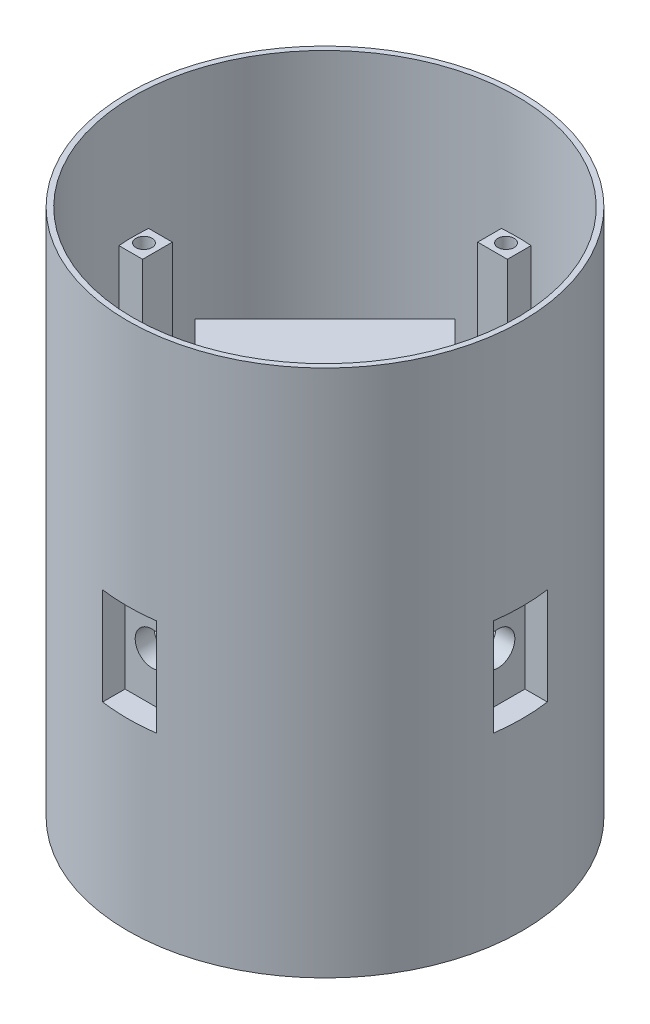
from build123d import *
from build123d.topology import SkipClean

# Parameters (mm, degrees)
SKETCH_4_W                = 68
SKETCH_4_H                = 1.5
EXTRUDE_1_DEPTH           = 34
EXTRUDE_1_2_DEPTH         = 34
EXTRUDE_1_3_DEPTH         = 34
EXTRUDE_1_4_DEPTH         = 34
EXTRUDE_1_5_DEPTH         = 34
SKETCH_1_R                = 73
SKETCH_1_R_2              = 71
EXTRUDE_2_DEPTH           = 97.5
EXTRUDE_START             = 33
SKETCH_6_W                = 24
SKETCH_6_H                = 10
EXTRUDE_4_DEPTH           = 20
EXTRUDE_START_2           = 62.006944
SKETCH_5_R                = 8.25
EXTRUDE_5_DEPTH           = 5
PATTERN_CIRCULAR_1_COUNT  = 4
SHELL_START               = -73.0000001
SHELL_4_OUTLINE_W         = 20
SHELL_4_OUTLINE_H         = 36
SHELL_4_DEPTH             = 8.99305599
SHELL_START_2             = 64.00694411
SHELL_4_2_OUTLINE_W       = 20
SHELL_4_2_OUTLINE_H       = 36
SHELL_4_2_DEPTH           = 8.99305589
SHELL_START_3             = -64.00694411
SHELL_4_3_OUTLINE_R       = 6.25
SHELL_4_3_DEPTH           = 5
SHELL_START_4             = 59.00694411
SHELL_4_4_OUTLINE_R       = 6.25
SHELL_4_4_DEPTH           = 5
SHELL_4_5_OUTLINE_W       = 36
SHELL_4_5_OUTLINE_H       = 20
SHELL_4_5_DEPTH           = 8.99305599
SHELL_4_6_OUTLINE_W       = 36
SHELL_4_6_OUTLINE_H       = 20
SHELL_4_6_DEPTH           = 8.99305589
SHELL_4_7_OUTLINE_R       = 6.25
SHELL_4_7_DEPTH           = 5
SHELL_4_8_OUTLINE_R       = 6.25
SHELL_4_8_DEPTH           = 5
SKETCH_8_R                = 6.25
CUT_EXTRUDE_7_DEPTH       = 2
PATTERN_CIRCULAR_17_COUNT = 4
SKETCH_1_43_R             = 73
EXTRUDE_6_DEPTH           = 8
EXTRUDE_START_3           = 53
SKETCH_6_4_W              = 11
SKETCH_6_4_H              = 10
EXTRUDE_7_DEPTH           = 44.5
PATTERN_CIRCULAR_18_COUNT = 4
SKETCH_10_R               = 6.65
CUT_EXTRUDE_8_DEPTH       = 8
EXTRUDE_4_2_DEPTH         = 8
SKETCH_9_3_R              = 1.5
CUT_EXTRUDE_9_DEPTH       = 6
SKETCH_11_R               = 1.5
CUT_EXTRUDE_10_DEPTH      = 6
CUT_EXTRUDE_START         = 97.5
SKETCH_6_7_R              = 3
CUT_EXTRUDE_11_DEPTH      = 6
PATTERN_CIRCULAR_19_COUNT = 4
EXTRUDE_START_4           = 97.5
SKETCH_1_44_R             = 73
SKETCH_1_44_R_2           = 71
EXTRUDE_9_DEPTH           = 45
EXTRUDE_START_5           = -8
SKETCH_1_45_R             = 73
SKETCH_1_45_R_2           = 71
EXTRUDE_10_DEPTH          = 45
SKETCH_1_46_R             = 1.5
CUT_EXTRUDE_12_DEPTH      = 6


# Read off the part's stored shape, not the designer's step: 薄殼4
with BuildPart() as part:
    # 草圖4 → 填料-伸長1 (new, symmetric)
    with BuildSketch(Plane(origin=(0, 0, 0), x_dir=(-0.7071067811865477, 0, 0.7071067811865475), z_dir=(-0.7071067811865475, 0, -0.7071067811865477))):
        with Locations((0, 15.75)):
            Rectangle(SKETCH_4_W, SKETCH_4_H)
    extrude(amount=EXTRUDE_1_DEPTH, both=True)


with BuildPart() as body_2:
    # 草圖4 → Extrude 1 2 (new, symmetric)
    with BuildSketch(Plane(origin=(0, 0, 0), x_dir=(-0.7071067811865477, 0, 0.7071067811865475), z_dir=(-0.7071067811865475, 0, -0.7071067811865477))):
        with Locations((0, 32.25)):
            Rectangle(SKETCH_4_W, SKETCH_4_H)
    extrude(amount=EXTRUDE_1_2_DEPTH, both=True)


with BuildPart() as body_3:
    # 草圖4 → Extrude 1 3 (new, symmetric)
    with BuildSketch(Plane(origin=(0, 0, 0), x_dir=(-0.7071067811865477, 0, 0.7071067811865475), z_dir=(-0.7071067811865475, 0, -0.7071067811865477))):
        with Locations((0, 48.75)):
            Rectangle(SKETCH_4_W, SKETCH_4_H)
    extrude(amount=EXTRUDE_1_3_DEPTH, both=True)


with BuildPart() as body_4:
    # 草圖4 → Extrude 1 4 (new, symmetric)
    with BuildSketch(Plane(origin=(0, 0, 0), x_dir=(-0.7071067811865477, 0, 0.7071067811865475), z_dir=(-0.7071067811865475, 0, -0.7071067811865477))):
        with Locations((0, 65.25)):
            Rectangle(SKETCH_4_W, SKETCH_4_H)
    extrude(amount=EXTRUDE_1_4_DEPTH, both=True)


with BuildPart() as body_5:
    # 草圖4 → Extrude 1 5 (new, symmetric)
    with BuildSketch(Plane(origin=(0, 0, 0), x_dir=(-0.7071067811865477, 0, 0.7071067811865475), z_dir=(-0.7071067811865475, 0, -0.7071067811865477))):
        with Locations((0, 81.75)):
            Rectangle(SKETCH_4_W, SKETCH_4_H)
    extrude(amount=EXTRUDE_1_5_DEPTH, both=True)


with BuildPart() as body_6:
    # 草圖1 → 填料-伸長2 (new body)
    with BuildSketch(Plane(origin=(0, 0, 0), x_dir=(1, 0, 0), z_dir=(0, 1, 0))):
        with Locations(Location((0, 0, 0), (0, 0, 270))):
            Circle(SKETCH_1_R)
        with Locations(Location((0, 0, 0), (0, 0, 270))):
            Circle(SKETCH_1_R_2, mode=Mode.SUBTRACT)
    extrude(amount=EXTRUDE_2_DEPTH)

    # 草圖6 → Extrude 4 (add, symmetric)
    with BuildSketch(Plane(origin=(0, 0, 0), x_dir=(1, 0, 0), z_dir=(0, 1, 0)).offset(EXTRUDE_START)):
        with Locations((0, -67.00694411)):
            Rectangle(SKETCH_6_W, SKETCH_6_H)
    extrude_4 = extrude(amount=EXTRUDE_4_DEPTH, both=True)

    # 草圖5 → 填料-伸長5 (add)
    with BuildSketch(Plane.XY.offset(EXTRUDE_START_2)):
        with Locations(Location((0, 33, 0), (0, 0, 180))):
            Circle(SKETCH_5_R)
    extrude_5 = extrude(amount=-EXTRUDE_5_DEPTH)

    # 環狀複製排列1: Extrude 4, 填料-伸長5 ×4 about axis
    pattern_circular_1_axis = Axis((0, 0, 0), (0, 1, 0))
    add([extrude_4.rotate(pattern_circular_1_axis, i * 360 / PATTERN_CIRCULAR_1_COUNT) for i in range(1, PATTERN_CIRCULAR_1_COUNT)])
    add([extrude_5.rotate(pattern_circular_1_axis, i * 360 / PATTERN_CIRCULAR_1_COUNT) for i in range(1, PATTERN_CIRCULAR_1_COUNT)])

    # 薄殼4 outline → 薄殼4 (cut)
    with BuildSketch(Plane.XY.offset(SHELL_START)):
        with Locations((0, 33)):
            Rectangle(SHELL_4_OUTLINE_W, SHELL_4_OUTLINE_H)
    extrude(amount=SHELL_4_DEPTH, mode=Mode.SUBTRACT)

    # Shell 4 2 outline → Shell 4 2 (cut)
    with BuildSketch(Plane.XY.offset(SHELL_START_2)):
        with Locations((0, 33)):
            Rectangle(SHELL_4_2_OUTLINE_W, SHELL_4_2_OUTLINE_H)
    extrude(amount=SHELL_4_2_DEPTH, mode=Mode.SUBTRACT)

    # Shell 4 3 outline → Shell 4 3 (cut)
    with BuildSketch(Plane.XY.offset(SHELL_START_3)):
        with Locations((0, 33)):
            Circle(SHELL_4_3_OUTLINE_R)
    extrude(amount=SHELL_4_3_DEPTH, mode=Mode.SUBTRACT)

    # Shell 4 4 outline → Shell 4 4 (cut)
    with BuildSketch(Plane.XY.offset(SHELL_START_4)):
        with Locations((0, 33)):
            Circle(SHELL_4_4_OUTLINE_R)
    extrude(amount=SHELL_4_4_DEPTH, mode=Mode.SUBTRACT)

    # Shell 4 5 outline → Shell 4 5 (cut)
    with BuildSketch(Plane.YZ.offset(SHELL_START)):
        with Locations((33, 0)):
            Rectangle(SHELL_4_5_OUTLINE_W, SHELL_4_5_OUTLINE_H)
    extrude(amount=SHELL_4_5_DEPTH, mode=Mode.SUBTRACT)

    # Shell 4 6 outline → Shell 4 6 (cut)
    with BuildSketch(Plane.YZ.offset(SHELL_START_2)):
        with Locations((33, 0)):
            Rectangle(SHELL_4_6_OUTLINE_W, SHELL_4_6_OUTLINE_H)
    extrude(amount=SHELL_4_6_DEPTH, mode=Mode.SUBTRACT)

    # Shell 4 7 outline → Shell 4 7 (cut)
    with BuildSketch(Plane.YZ.offset(SHELL_START_3)):
        with Locations((33, 0)):
            Circle(SHELL_4_7_OUTLINE_R)
    extrude(amount=SHELL_4_7_DEPTH, mode=Mode.SUBTRACT)

    # Shell 4 8 outline → Shell 4 8 (cut)
    with BuildSketch(Plane.YZ.offset(SHELL_START_4)):
        with Locations((33, 0)):
            Circle(SHELL_4_8_OUTLINE_R)
    extrude(amount=SHELL_4_8_DEPTH, mode=Mode.SUBTRACT)

    # 草圖8 → 除料-伸長7 (cut)
    with BuildSketch(Plane.ZY.offset(59.00694411)):
        with Locations((0, 33)):
            Circle(SKETCH_8_R)
    cut_extrude_7 = extrude(amount=-CUT_EXTRUDE_7_DEPTH, mode=Mode.SUBTRACT)

    # 環狀複製排列17: 除料-伸長7 ×4 about axis
    with SkipClean():  # the faces are left unmerged after this step: merging them gives an invalid solid
        pattern_circular_17_axis = Axis((0, 97.5, 0), (0, -1, 0))
        for i in range(1, PATTERN_CIRCULAR_17_COUNT):
            add(cut_extrude_7.rotate(pattern_circular_17_axis, i * 360 / PATTERN_CIRCULAR_17_COUNT), mode=Mode.SUBTRACT)

    # 草圖1<43> → 填料-伸長6 (add)
    with BuildSketch(Plane(origin=(0, 0, 0), x_dir=(1, 0, 0), z_dir=(0, 1, 0))):
        with Locations(Location((0, 0, 0), (0, 0, 270))):
            Circle(SKETCH_1_43_R)
    extrude(amount=-EXTRUDE_6_DEPTH)

    # 草圖6<4> → 填料-伸長7 (add)
    with BuildSketch(Plane(origin=(0, 0, 0), x_dir=(1, 0, 0), z_dir=(0, 1, 0)).offset(EXTRUDE_START_3)):
        with Locations((0, -67.00694411)):
            Rectangle(SKETCH_6_4_W, SKETCH_6_4_H)
    extrude_7 = extrude(amount=EXTRUDE_7_DEPTH)

    # 環狀複製排列18: 填料-伸長7 ×4 about axis
    pattern_circular_18_axis = Axis((0, 0, 0), (0, 1, 0))
    for i in range(1, PATTERN_CIRCULAR_18_COUNT):
        add(extrude_7.rotate(pattern_circular_18_axis, i * 360 / PATTERN_CIRCULAR_18_COUNT))

    # 草圖10 → 除料-伸長8 (cut)
    with BuildSketch(Plane(origin=(0, 0, 0), x_dir=(1, 0, 0), z_dir=(0, 1, 0))):
        with Locations(Location((15.179413453, -47.433616995, 0), (0, 0, 270))):
            Circle(SKETCH_10_R)
    extrude(amount=-CUT_EXTRUDE_8_DEPTH, mode=Mode.SUBTRACT)

    # 草圖9 → Extrude 4 2 (add)
    with BuildSketch(Plane(origin=(0, 0, 0), x_dir=(1, 0, 0), z_dir=(0, 1, 0))):
        Polygon((-21.342499834, -28.181142035), (-6.846810819, -42.67683105), (-18.514072709, -54.344092939), (-33.009761723, -39.848403925), align=None)
        Polygon((-21.342499834, -31.00956916), (-9.675237944, -42.67683105), (-18.514072709, -51.515665814), (-30.181334598, -39.848403925), align=None, mode=Mode.SUBTRACT)
    extrude(amount=EXTRUDE_4_2_DEPTH)

    # 草圖9<3> → 除料-伸長9 (cut)
    with BuildSketch(Plane(origin=(0, 0, 0), x_dir=(1, 0, 0), z_dir=(0, 1, 0))):
        with Locations(Location((-29.120674427, -32.070229332, 0), (0, 0, 270))):
            Circle(SKETCH_9_3_R)
        with Locations(Location((-10.735898116, -50.455005643, 0), (0, 0, 270))):
            Circle(SKETCH_9_3_R)
    extrude(amount=-CUT_EXTRUDE_9_DEPTH, mode=Mode.SUBTRACT)

    # 草圖11 → 除料-伸長10 (cut)
    with BuildSketch(Plane(origin=(0, 0, 0), x_dir=(1, 0, 0), z_dir=(0, 1, 0))):
        with Locations(Location((-17.38331229, 38.682051461, 0), (0, 0, 270))):
            Circle(SKETCH_11_R)
        with Locations(Location((-38.596515726, 17.468848025, 0), (0, 0, 270))):
            Circle(SKETCH_11_R)
        with Locations(Location((44.488531064, -26.725325799, 0), (0, 0, 270))):
            Circle(SKETCH_11_R)
        with Locations(Location((26.810861534, -44.402995328, 0), (0, 0, 270))):
            Circle(SKETCH_11_R)
    extrude(amount=-CUT_EXTRUDE_10_DEPTH, mode=Mode.SUBTRACT)

    # 草圖6<7> → 除料-伸長11 (cut)
    with BuildSketch(Plane(origin=(0, 0, 0), x_dir=(1, 0, 0), z_dir=(0, 1, 0)).offset(CUT_EXTRUDE_START)):
        with Locations(Location((0, -67.00694411, 0), (0, 0, 270))):
            Circle(SKETCH_6_7_R)
    cut_extrude_11 = extrude(amount=-CUT_EXTRUDE_11_DEPTH, mode=Mode.SUBTRACT)

    # 環狀複製排列19: 除料-伸長11 ×4 about axis
    pattern_circular_19_axis = Axis((0, 0, 0), (0, 1, 0))
    for i in range(1, PATTERN_CIRCULAR_19_COUNT):
        add(cut_extrude_11.rotate(pattern_circular_19_axis, i * 360 / PATTERN_CIRCULAR_19_COUNT), mode=Mode.SUBTRACT)

    # 草圖1<44> → 填料-伸長9 (add)
    with BuildSketch(Plane(origin=(0, 0, 0), x_dir=(1, 0, 0), z_dir=(0, 1, 0)).offset(EXTRUDE_START_4)):
        with Locations(Location((0, 0, 0), (0, 0, 270))):
            Circle(SKETCH_1_44_R)
        with Locations(Location((0, 0, 0), (0, 0, 270))):
            Circle(SKETCH_1_44_R_2, mode=Mode.SUBTRACT)
    extrude(amount=EXTRUDE_9_DEPTH)

    # 草圖1<45> → 填料-伸長10 (add)
    with BuildSketch(Plane(origin=(0, 0, 0), x_dir=(1, 0, 0), z_dir=(0, 1, 0)).offset(EXTRUDE_START_5)):
        with Locations(Location((0, 0, 0), (0, 0, 270))):
            Circle(SKETCH_1_45_R)
        with Locations(Location((0, 0, 0), (0, 0, 270))):
            Circle(SKETCH_1_45_R_2, mode=Mode.SUBTRACT)
    extrude(amount=-EXTRUDE_10_DEPTH)

    # 草圖1<46> → 除料-伸長12 (cut)
    with BuildSketch(Plane(origin=(0, 0, 0), x_dir=(1, 0, 0), z_dir=(0, 1, 0))):
        with Locations(Location((42.426406871, 0, 0), (0, 0, 270))):
            Circle(SKETCH_1_46_R)
        with Locations(Location((0, -42.426406871, 0), (0, 0, 270))):
            Circle(SKETCH_1_46_R)
        with Locations(Location((-42.426406871, 0, 0), (0, 0, 270))):
            Circle(SKETCH_1_46_R)
        with Locations(Location((0, 42.426406871, 0), (0, 0, 270))):
            Circle(SKETCH_1_46_R)
    extrude(amount=-CUT_EXTRUDE_12_DEPTH, mode=Mode.SUBTRACT)


solid = Compound([part.part, body_2.part, body_3.part, body_4.part, body_5.part, body_6.part])
